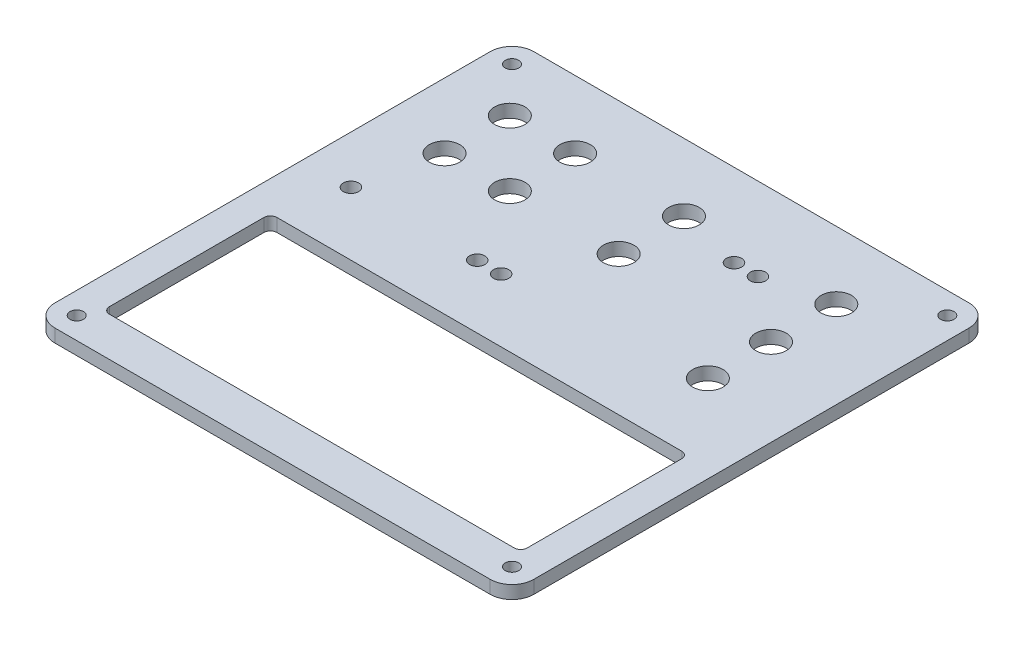
from build123d import *

# Parameters (mm, degrees)
SKETCH1_W           = 110
SKETCH1_H           = 110
SKETCH1_R           = 1.55
BOSS_EXTRUDE1_DEPTH = 3
FILLET1_R           = 5
SKETCH2_W           = 96
SKETCH2_H           = 38.5
CUT_EXTRUDE1_DEPTH  = 78.839578622
FILLET2_R           = 1.5
SKETCH3_R           = 3.5
CUT_EXTRUDE2_DEPTH  = 78.839578622
SKETCH4_R           = 1.75
CUT_EXTRUDE3_DEPTH  = 78.839578622


with BuildPart() as part:
    # Sketch1 → Boss-Extrude1 (new body)
    with BuildSketch(Plane(origin=(0, 0, 0), x_dir=(1, 0, 0), z_dir=(0, 1, 0))):
        Rectangle(SKETCH1_W, SKETCH1_H)
        with Locations((-50, 50)):
            Circle(SKETCH1_R, mode=Mode.SUBTRACT)
        with Locations((50, 50)):
            Circle(SKETCH1_R, mode=Mode.SUBTRACT)
        with Locations((50, -50)):
            Circle(SKETCH1_R, mode=Mode.SUBTRACT)
        with Locations((-50, -50)):
            Circle(SKETCH1_R, mode=Mode.SUBTRACT)
    extrude(amount=BOSS_EXTRUDE1_DEPTH)

    # Fillet1
    fillet1_edges = [part.edges().sort_by_distance(p)[0] for p in [
        (-55, 1.5, -55),
        (55, 1.5, -55),
        (55, 1.5, 55),
        (-55, 1.5, 55),
    ]]
    fillet(fillet1_edges, radius=FILLET1_R)

    # Sketch2 → Cut-Extrude1 (cut, through all)
    with BuildSketch(Plane(origin=(0, 3, 0), x_dir=(1, 0, 0), z_dir=(0, 1, 0))):
        with Locations((0, -26.75)):
            Rectangle(SKETCH2_W, SKETCH2_H)
    extrude(amount=-CUT_EXTRUDE1_DEPTH, mode=Mode.SUBTRACT)

    # Fillet2
    fillet2_edges = [part.edges().sort_by_distance(p)[0] for p in [
        (-48, 1.5, 46),
        (48, 1.5, 46),
        (48, 1.5, 7.5),
        (-48, 1.5, 7.5),
    ]]
    fillet(fillet2_edges, radius=FILLET2_R)

    # Sketch3 → Cut-Extrude2 (cut, through all)
    with BuildSketch(Plane(origin=(0, 3, 0), x_dir=(1, 0, 0), z_dir=(0, 1, 0))):
        with Locations((-40, 39.5)):
            Circle(SKETCH3_R)
        with Locations((-40, 24.5)):
            Circle(SKETCH3_R)
        with Locations((-25, 39.5)):
            Circle(SKETCH3_R)
        with Locations((-25, 24.5)):
            Circle(SKETCH3_R)
        with Locations((0, 39.5)):
            Circle(SKETCH3_R)
        with Locations((0, 24.5)):
            Circle(SKETCH3_R)
        with Locations((35, 39.5)):
            Circle(SKETCH3_R)
        with Locations((35, 24.5)):
            Circle(SKETCH3_R)
        with Locations((35, 10)):
            Circle(SKETCH3_R)
    extrude(amount=-CUT_EXTRUDE2_DEPTH, mode=Mode.SUBTRACT)

    # Sketch4 → Cut-Extrude3 (cut, through all)
    with BuildSketch(Plane(origin=(0, 3, 0), x_dir=(1, 0, 0), z_dir=(0, 1, 0))):
        with Locations((-44, 7)):
            Circle(SKETCH4_R)
        with Locations((-15, 7)):
            Circle(SKETCH4_R)
        with Locations((-9.5, 7)):
            Circle(SKETCH4_R)
        with Locations((15, 36)):
            Circle(SKETCH4_R)
        with Locations((20.5, 36)):
            Circle(SKETCH4_R)
    extrude(amount=-CUT_EXTRUDE3_DEPTH, mode=Mode.SUBTRACT)


solid = part.part
